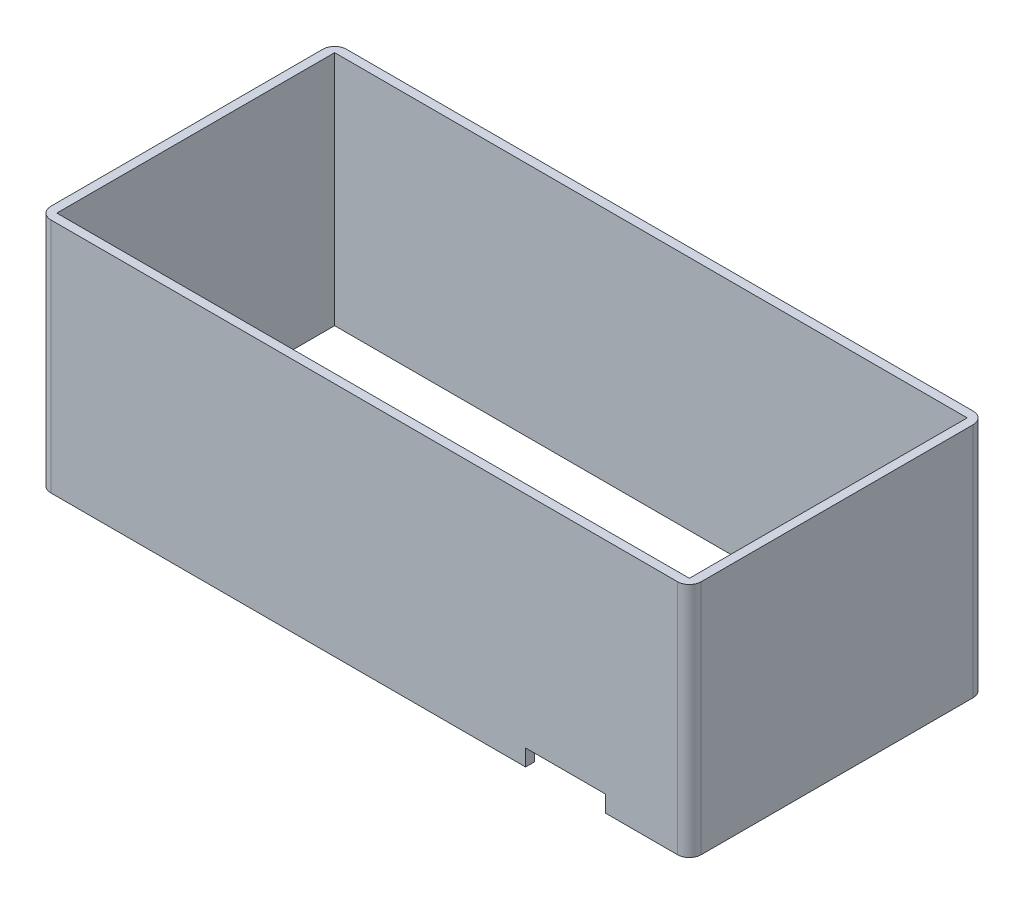
from build123d import *

# Parameters (mm, degrees)
STOCK_FULL_START               = 5
STOCK_FULL_SHAPE_1_OUTLINE_W   = 110
STOCK_FULL_SHAPE_1_OUTLINE_H   = 50
STOCK_FULL_SHAPE_1_OUTLINE_W_2 = 107
STOCK_FULL_SHAPE_1_OUTLINE_H_2 = 47
STOCK_FULL_SHAPE_1_DEPTH       = 40
FILLET1_R                      = 2
SKETCH3_W                      = 13.5
SKETCH3_H                      = 1.5
CUT_EXTRUDE1_DEPTH             = 2.8


# Read off the part's stored shape, not the designer's step: Stock-full shape-1
with BuildPart() as part:
    # Stock-full shape-1 outline → Stock-full shape-1 (new body)
    with BuildSketch(Plane(origin=(0, 0, 0), x_dir=(1, 0, 0), z_dir=(0, 1, 0)).offset(STOCK_FULL_START)):
        with Locations((14.090909091, -5.886363636)):
            Rectangle(STOCK_FULL_SHAPE_1_OUTLINE_W, STOCK_FULL_SHAPE_1_OUTLINE_H)
        with Locations((14.090909091, -5.886363636)):
            Rectangle(STOCK_FULL_SHAPE_1_OUTLINE_W_2, STOCK_FULL_SHAPE_1_OUTLINE_H_2, mode=Mode.SUBTRACT)
    extrude(amount=STOCK_FULL_SHAPE_1_DEPTH)

    # Fillet1
    fillet1_edges = [part.edges().sort_by_distance(p)[0] for p in [
        (-40.909090909, 25, -19.113636364),
        (69.090909091, 25, -19.113636364),
        (69.090909091, 25, 30.886363636),
        (-40.909090909, 25, 30.886363636),
    ]]
    fillet(fillet1_edges, radius=FILLET1_R)

    # Sketch3 → Cut-Extrude1 (cut)
    with BuildSketch(Plane.XZ.offset(-5)):
        with Locations((48.140909091, 30.136363636)):
            Rectangle(SKETCH3_W, SKETCH3_H)
    extrude(amount=-CUT_EXTRUDE1_DEPTH, mode=Mode.SUBTRACT)


solid = part.part
